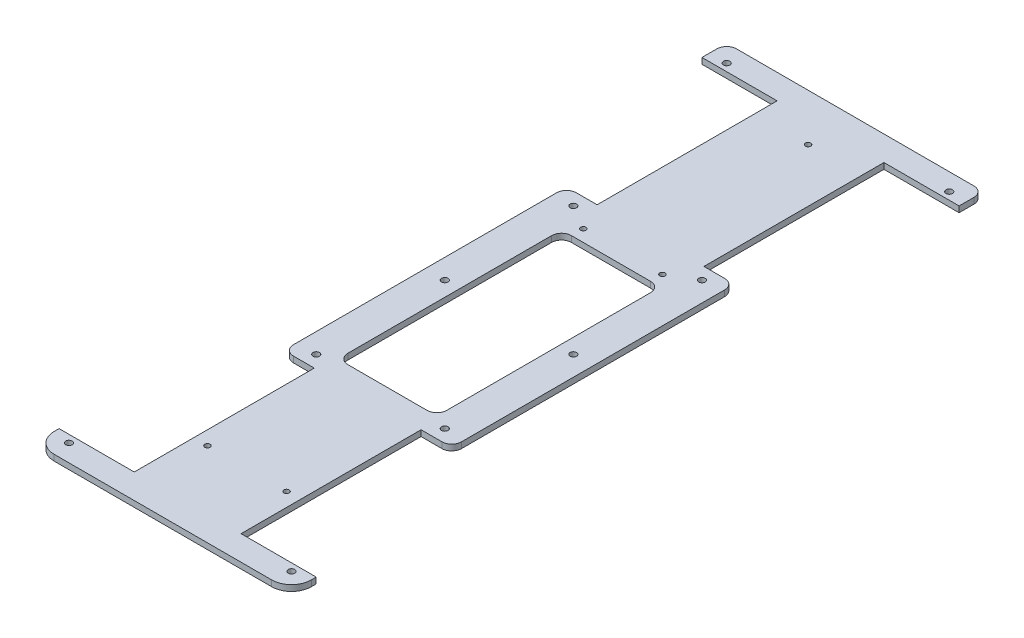
from build123d import *

# Parameters (mm, degrees)
BOSS_EXTRUDE1_DEPTH = 3
FILLET1_R           = 10
FILLET2_R           = 5
SKETCH2_R           = 1.65
CUT_EXTRUDE1_DEPTH  = 374.375146468
SKETCH3_R           = 1.65
CUT_EXTRUDE2_DEPTH  = 374.375146468
SKETCH4_R           = 1.65
CUT_EXTRUDE3_DEPTH  = 374.375146468
SKETCH5_R           = 1.35
CUT_EXTRUDE4_DEPTH  = 10
SKETCH6_W           = 50
SKETCH6_H           = 113
CUT_EXTRUDE5_DEPTH  = 10
FILLET4_R           = 5


with BuildPart() as part:
    # Sketch1 → Boss-Extrude1 (new body)
    with BuildSketch(Plane(origin=(0, 0, 0), x_dir=(1, 0, 0), z_dir=(0, 1, 0))):
        Polygon((0, 0), (130, 0), (130, 12.5), (92, 12.5), (92, 103.5), (107.5, 103.5), (107.5, 246.5), (92, 246.5), (92, 337.5), (130, 337.5), (130, 350), (0, 350), (0, 337.5), (38, 337.5), (38, 246.5), (22.5, 246.5), (22.5, 103.5), (38, 103.5), (38, 12.5), (0, 12.5), align=None)
    extrude(amount=BOSS_EXTRUDE1_DEPTH)

    # Fillet1
    fillet1_edges = [part.edges().sort_by_distance(p)[0] for p in [
        (130, 1.5, 0),
        (0, 1.5, 0),
    ]]
    fillet(fillet1_edges, radius=FILLET1_R)

    # Fillet2
    fillet2_edges = [part.edges().sort_by_distance(p)[0] for p in [
        (0, 1.5, -350),
        (130, 1.5, -350),
        (107.5, 1.5, -246.5),
        (107.5, 1.5, -103.5),
        (22.5, 1.5, -103.5),
        (22.5, 1.5, -246.5),
    ]]
    fillet(fillet2_edges, radius=FILLET2_R)

    # Sketch2 → Cut-Extrude1 (cut, through all)
    with BuildSketch(Plane(origin=(0, 3, 0), x_dir=(1, 0, 0), z_dir=(0, 1, 0))):
        with Locations((32.5, 240)):
            Circle(SKETCH2_R)
        with Locations((32.5, 175)):
            Circle(SKETCH2_R)
        with Locations((32.5, 110)):
            Circle(SKETCH2_R)
        with Locations((97.5, 110)):
            Circle(SKETCH2_R)
        with Locations((97.5, 175)):
            Circle(SKETCH2_R)
        with Locations((97.5, 240)):
            Circle(SKETCH2_R)
    extrude(amount=-CUT_EXTRUDE1_DEPTH, mode=Mode.SUBTRACT)

    # Sketch3 → Cut-Extrude2 (cut, through all)
    with BuildSketch(Plane(origin=(0, 3, 0), x_dir=(1, 0, 0), z_dir=(0, 1, 0))):
        with Locations((8.75, 8.75)):
            Circle(SKETCH3_R)
        with Locations((121.25, 8.75)):
            Circle(SKETCH3_R)
    extrude(amount=-CUT_EXTRUDE2_DEPTH, mode=Mode.SUBTRACT)

    # Sketch4 → Cut-Extrude3 (cut, through all)
    with BuildSketch(Plane(origin=(0, 3, 0), x_dir=(1, 0, 0), z_dir=(0, 1, 0))):
        with Locations((8.75, 341.25)):
            Circle(SKETCH4_R)
        with Locations((121.25, 341.25)):
            Circle(SKETCH4_R)
    extrude(amount=-CUT_EXTRUDE3_DEPTH, mode=Mode.SUBTRACT)

    # Sketch5 → Cut-Extrude4 (cut)
    with BuildSketch(Plane(origin=(0, 3, 0), x_dir=(1, 0, 0), z_dir=(0, 1, 0))):
        with Locations((45, 42.5)):
            Circle(SKETCH5_R)
        with Locations((85, 42.5)):
            Circle(SKETCH5_R)
        with Locations((45, 232.5)):
            Circle(SKETCH5_R)
        with Locations((85, 232.5)):
            Circle(SKETCH5_R)
        with Locations((65, 326.15)):
            Circle(SKETCH5_R)
    extrude(amount=-CUT_EXTRUDE4_DEPTH, mode=Mode.SUBTRACT)

    # Sketch6 → Cut-Extrude5 (cut)
    with BuildSketch(Plane(origin=(0, 3, 0), x_dir=(1, 0, 0), z_dir=(0, 1, 0))):
        with Locations((65, 170)):
            Rectangle(SKETCH6_W, SKETCH6_H)
    extrude(amount=-CUT_EXTRUDE5_DEPTH, mode=Mode.SUBTRACT)

    # Fillet4
    fillet4_edges = [part.edges().sort_by_distance(p)[0] for p in [
        (90, 1.5, -113.5),
        (40, 1.5, -113.5),
        (90, 1.5, -226.5),
        (40, 1.5, -226.5),
    ]]
    fillet(fillet4_edges, radius=FILLET4_R)


solid = part.part
